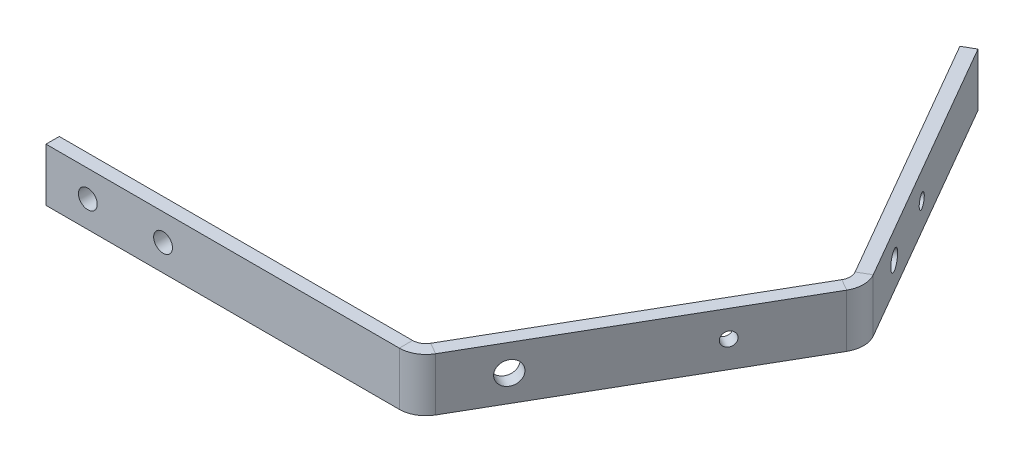
from build123d import *

# Parameters (mm, degrees)
ESBO_O2_W               = 235
ESBO_O2_H               = 12.7
FLANGE_BASE1_DEPTH      = 3.175
DOBRA_START             = -6.35
DOBRA_ESBO_ADA1_DEPTH   = 12.7
DOBRA_ESBO_ADA1_2_DEPTH = 12.7
DOBRA_ESBO_ADA2_DEPTH   = 12.7
DOBRA_ESBO_ADA2_2_DEPTH = 12.7
ESBO_O11_R              = 2.250000001
CORTE_EXTRUS_O1_DEPTH   = 10
ESBO_O13_R              = 2.750000001
CORTE_EXTRUS_O3_DEPTH   = 10
ESBO_O16_R              = 2.25
CORTE_EXTRUS_O5_DEPTH   = 10
ESBO_O17_R              = 2.25
ESBO_O17_R_2            = 1.65
CORTE_EXTRUS_O6_DEPTH   = 10
ESBO_O18_R              = 1.650000002
CORTE_EXTRUS_O7_DEPTH   = 10


# Read off the part's stored shape, not the designer's step: Dobra esboçada1, Dobra esboçada2
# Sheet-metal steps are written as plain solids
with BuildPart() as part:
    # Esboço2 → Flange-base1 (new body)
    with BuildSketch(Plane.XY):
        Rectangle(ESBO_O2_W, ESBO_O2_H)
    extrude(amount=-FLANGE_BASE1_DEPTH)

    # Dobra esboçada1 outline → Dobra esboçada1 (cut)
    with BuildSketch(Plane(origin=(0, 0, 0), x_dir=(1, 0, 0), z_dir=(0, 1, 0)).offset(DOBRA_START)):
        with BuildLine():
            Line((117.5, 3.175), (-27.464109855, 3.175))
            ThreePointArc((-27.464109855, 3.175), (-29.790007409, 0.850686918), (-32.966257163, 0))
            Line((-32.966257163, 0), (117.5, 0))
            Line((117.5, 0), (117.5, 3.175))
        make_face()
    extrude(amount=DOBRA_ESBO_ADA1_DEPTH, mode=Mode.SUBTRACT)

    # Dobra esbo_ada1 2 outline → Dobra esbo_ada1 2 (add)
    with BuildSketch(Plane(origin=(0, 0, 0), x_dir=(1, 0, 0), z_dir=(0, 1, 0)).offset(DOBRA_START)):
        with BuildLine():
            Line((45.274205697, 129.161456881), (42.52457504, 130.748956881))
            Line((42.52457504, 130.748956881), (-30.212296379, 4.765))
            ThreePointArc((-30.212296379, 4.765), (-31.376257163, 3.601039216), (-32.966257163, 3.175))
            Line((-32.966257163, 3.175), (-27.464109855, 3.175))
            ThreePointArc((-27.464109855, 3.175), (-27.463387647, 3.176249918), (-27.462665722, 3.1775))
            Line((-27.462665722, 3.1775), (45.274205697, 129.161456881))
        make_face()
    extrude(amount=DOBRA_ESBO_ADA1_2_DEPTH)

    # Dobra esboçada2 outline → Dobra esboçada2 (cut)
    with BuildSketch(Plane(origin=(0, 0, 0), x_dir=(1, 0, 0), z_dir=(0, 1, 0)).offset(DOBRA_START)):
        with BuildLine():
            Line((42.52457504, 130.748956881), (8.540648694, 71.887069809))
            ThreePointArc((8.540648694, 71.887069809), (9.390614092, 68.7106269), (8.539205697, 65.534570465))
            Line((8.539205697, 65.534570465), (45.274205697, 129.161456881))
            Line((45.274205697, 129.161456881), (42.52457504, 130.748956881))
        make_face()
    extrude(amount=DOBRA_ESBO_ADA2_DEPTH, mode=Mode.SUBTRACT)

    # Dobra esbo_ada2 2 outline → Dobra esbo_ada2 2 (add)
    with BuildSketch(Plane(origin=(0, 0, 0), x_dir=(1, 0, 0), z_dir=(0, 1, 0)).offset(DOBRA_START)):
        with BuildLine():
            Line((-28.449167797, 129.605312646), (5.78957504, 70.302070465))
            ThreePointArc((5.78957504, 70.302070465), (6.215614256, 68.712070465), (5.78957504, 67.122070465))
            Line((5.78957504, 67.122070465), (8.540648694, 71.887069809))
            ThreePointArc((8.540648694, 71.887069809), (8.539927338, 71.888320219), (8.539205697, 71.889570465))
            Line((8.539205697, 71.889570465), (-25.69953714, 131.192812646))
            Line((-25.69953714, 131.192812646), (-28.449167797, 129.605312646))
        make_face()
    extrude(amount=DOBRA_ESBO_ADA2_2_DEPTH)

    # Esboço11 → Corte-extrusão1 (cut)
    with BuildSketch(Plane(origin=(0, 0, -3.175), x_dir=(-1, 0, 0), z_dir=(0, 0, -1))):
        with Locations((89.489373825, 0)):
            Circle(ESBO_O11_R)
    extrude(amount=-CORTE_EXTRUS_O1_DEPTH, mode=Mode.SUBTRACT)

    # Esboço13 → Corte-extrusão3 (cut)
    with BuildSketch(Plane(origin=(-21.972897151, 0, -12.686058085), x_dir=(0.49999999999999806, 0, -0.8660254037844398), z_dir=(0.8660254037844397, 0, 0.499999999999998))):
        with Locations((1.928330412, 0)):
            Circle(ESBO_O13_R)
    extrude(amount=-CORTE_EXTRUS_O3_DEPTH, mode=Mode.SUBTRACT)

    # Esboço16 → Corte-extrusão5 (cut)
    with BuildSketch(Plane(origin=(0, 0, -3.175), x_dir=(-1, 0, 0), z_dir=(0, 0, -1))):
        with Locations((107.489373825, 0)):
            Circle(ESBO_O16_R)
    extrude(amount=-CORTE_EXTRUS_O5_DEPTH, mode=Mode.SUBTRACT)

    # Esboço17 → Corte-extrusão6 (cut)
    with BuildSketch(Plane(origin=(34.783870761, 0, -20.082477147), x_dir=(0.5000000000000041, 0, 0.8660254037844364), z_dir=(-0.8660254037844363, 0, 0.500000000000004))):
        with Locations((-71.692454523, 0)):
            Circle(ESBO_O17_R)
        with Locations((-89.692454522, 0)):
            Circle(ESBO_O17_R_2)
    extrude(amount=-CORTE_EXTRUS_O6_DEPTH, mode=Mode.SUBTRACT)

    # Esboço18 → Corte-extrusão7 (cut)
    with BuildSketch(Plane(origin=(-24.722527808, 0, -14.273558085), x_dir=(-0.49999999999999806, 0, 0.8660254037844398), z_dir=(-0.8660254037844397, 0, -0.499999999999998))):
        with Locations((-40.351796828, 0)):
            Circle(ESBO_O18_R)
    extrude(amount=-CORTE_EXTRUS_O7_DEPTH, mode=Mode.SUBTRACT)


solid = part.part
